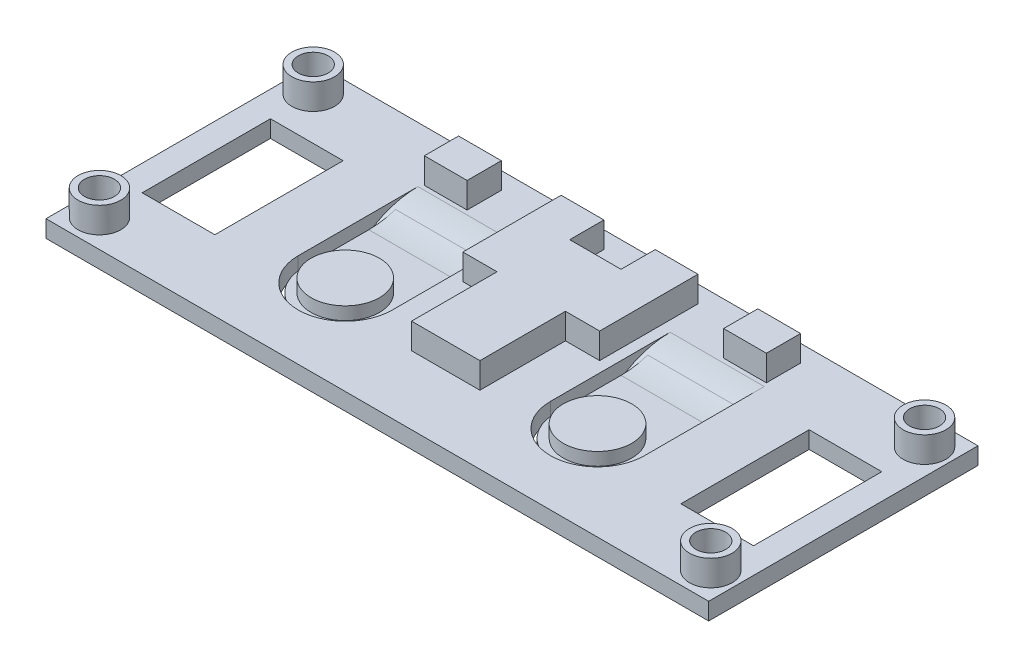
from build123d import *

# Parameters (mm, degrees)
SKETCH1_W                 = 77.5
SKETCH1_H                 = 31.5
BOSS_EXTRUDE1_DEPTH       = 2
CUT_EXTRUDE1_DEPTH        = 42.87630595
CUT_EXTRUDE1_DEPTH_BACK   = 42.87630595
SKETCH2_R                 = 1.75
CUT_EXTRUDE2_DEPTH        = 42.87630595
CUT_EXTRUDE2_DEPTH_BACK   = 42.87630595
SKETCH3_W                 = 8.5
SKETCH3_H                 = 15
BOSS_EXTRUDE2_START       = 3
SKETCH4_R                 = 2.5
SKETCH4_R_2               = 1.75
BOSS_EXTRUDE2_DEPTH       = 3
MIRROR2_START             = 3
MIRROR2_COPY_1_SKETCH_R   = 2.5
MIRROR2_COPY_1_SKETCH_R_2 = 1.75
MIRROR2_COPY_1_DEPTH      = 3
CUT_EXTRUDE3_DEPTH        = 3.5
SKETCH6_W                 = 8
SKETCH6_H                 = 10
SKETCH6_W_2               = 5
SKETCH6_H_2               = 4
BOSS_EXTRUDE3_DEPTH       = 3
SKETCH7_W                 = 16
SKETCH7_H                 = 7.5
BOSS_EXTRUDE4_DEPTH       = 3
CUT_EXTRUDE4_DEPTH        = 1
FILLET1_R                 = 10
FILLET2_R                 = 10
SKETCH9_R                 = 4
BOSS_EXTRUDE6_DEPTH       = 1.5


with BuildPart() as part:
    # Sketch1 → Boss-Extrude1 (new body)
    with BuildSketch(Plane(origin=(0, 0, 0), x_dir=(1, 0, 0), z_dir=(0, 1, 0))):
        Rectangle(SKETCH1_W, SKETCH1_H)
    extrude(amount=BOSS_EXTRUDE1_DEPTH)

    # Sketch2 → Cut-Extrude1 (cut, two sides: drawn at the far end of the back side and taken through both)
    with BuildSketch(Plane(origin=(0, 2, 0), x_dir=(1, 0, 0), z_dir=(0, 1, 0)).offset(-CUT_EXTRUDE1_DEPTH_BACK)):
        with Locations(Location((-35.75, 12.5, 0), (0, 0, 270))):
            Circle(SKETCH2_R)
        with Locations(Location((-35.75, -12.5, 0), (0, 0, 270))):
            Circle(SKETCH2_R)
        with Locations(Location((35.75, -12.5, 0), (0, 0, 270))):
            Circle(SKETCH2_R)
        with Locations(Location((35.75, 12.5, 0), (0, 0, 270))):
            Circle(SKETCH2_R)
    extrude(amount=CUT_EXTRUDE1_DEPTH + CUT_EXTRUDE1_DEPTH_BACK, mode=Mode.SUBTRACT)

    # Sketch3 → Cut-Extrude2 (cut, two sides: drawn at the far end of the back side and taken through both)
    with BuildSketch(Plane(origin=(0, 2, 0), x_dir=(1, 0, 0), z_dir=(0, 1, 0)).offset(-CUT_EXTRUDE2_DEPTH_BACK)):
        with Locations((31.5, 0)):
            Rectangle(SKETCH3_W, SKETCH3_H)
        with Locations((-31.5, 0)):
            Rectangle(SKETCH3_W, SKETCH3_H)
    extrude(amount=CUT_EXTRUDE2_DEPTH + CUT_EXTRUDE2_DEPTH_BACK, mode=Mode.SUBTRACT)

    # Sketch4 → Boss-Extrude2 (add)
    with BuildSketch(Plane(origin=(0, 2, 0), x_dir=(1, 0, 0), z_dir=(0, 1, 0)).offset(BOSS_EXTRUDE2_START)):
        with Locations(Location((-35.75, 12.5, 0), (0, 0, 270))):
            Circle(SKETCH4_R)
        with Locations(Location((-35.75, 12.5, 0), (0, 0, 270))):
            Circle(SKETCH4_R_2, mode=Mode.SUBTRACT)
    boss_extrude2 = extrude(amount=-BOSS_EXTRUDE2_DEPTH)

    # Mirror1: Boss-Extrude2 across plane
    add(boss_extrude2.mirror(Plane.XY))

    # Mirror2: Boss-Extrude2 across plane
    add(boss_extrude2.mirror(Plane(origin=(0, 0, 0), x_dir=(0, 0, 1), z_dir=(1, 0, 0))))

    # Mirror2 copy 1 sketch → Mirror2 copy 1 (add)
    with BuildSketch(Plane(origin=(0, 2, 0), x_dir=(-1, 0, 0), z_dir=(0, 1, 0)).offset(MIRROR2_START)):
        with Locations(Location((-35.75, 12.5, 0), (0, 0, 270))):
            Circle(MIRROR2_COPY_1_SKETCH_R)
        with Locations(Location((-35.75, 12.5, 0), (0, 0, 270))):
            Circle(MIRROR2_COPY_1_SKETCH_R_2, mode=Mode.SUBTRACT)
    extrude(amount=-MIRROR2_COPY_1_DEPTH)

    # Sketch5 → Cut-Extrude3 (cut)
    with BuildSketch(Plane(origin=(0, 2, 0), x_dir=(1, 0, 0), z_dir=(0, 1, 0))):
        with BuildLine():
            Line((19.75, -4.75), (19.75, 3.25))
            Line((19.75, 3.25), (20.25, 3.25))
            Line((20.25, 3.25), (20.25, -4.75))
            ThreePointArc((20.25, -4.75), (14.75, -10.25), (9.25, -4.75))
            Line((9.25, -4.75), (9.25, 3.25))
            Line((9.25, 3.25), (9.75, 3.25))
            Line((9.75, 3.25), (9.75, -4.75))
            ThreePointArc((9.75, -4.75), (14.75, -9.75), (19.75, -4.75))
        make_face()
        with BuildLine():
            Line((-19.75, 3.25), (-20.25, 3.25))
            Line((-20.25, 3.25), (-20.25, -4.75))
            ThreePointArc((-20.25, -4.75), (-14.75, -10.25), (-9.25, -4.75))
            Line((-9.25, -4.75), (-9.25, 3.25))
            Line((-9.25, 3.25), (-9.75, 3.25))
            Line((-9.75, 3.25), (-9.75, -4.75))
            ThreePointArc((-9.75, -4.75), (-14.75, -9.75), (-19.75, -4.75))
            Line((-19.75, -4.75), (-19.75, 3.25))
        make_face()
    extrude(amount=-CUT_EXTRUDE3_DEPTH, mode=Mode.SUBTRACT)

    # Sketch6 → Boss-Extrude3 (add)
    with BuildSketch(Plane(origin=(0, 2, 0), x_dir=(1, 0, 0), z_dir=(0, 1, 0))):
        with Locations((0, -2.75)):
            Rectangle(SKETCH6_W, SKETCH6_H)
        with Locations((5.5, 11.75)):
            Rectangle(SKETCH6_W_2, SKETCH6_H_2)
        with Locations((17.5, 11.75)):
            Rectangle(SKETCH6_W_2, SKETCH6_H_2)
        with Locations((-17.5, 11.75)):
            Rectangle(SKETCH6_W_2, SKETCH6_H_2)
        with Locations((-5.5, 11.75)):
            Rectangle(SKETCH6_W_2, SKETCH6_H_2)
    extrude(amount=BOSS_EXTRUDE3_DEPTH)

    # Sketch7 → Boss-Extrude4 (add)
    with BuildSketch(Plane(origin=(0, 2, 0), x_dir=(1, 0, 0), z_dir=(0, 1, 0))):
        with Locations((0, 6)):
            Rectangle(SKETCH7_W, SKETCH7_H)
    extrude(amount=BOSS_EXTRUDE4_DEPTH)

    # Sketch8 → Cut-Extrude4 (cut)
    with BuildSketch(Plane(origin=(0, 2, 0), x_dir=(1, 0, 0), z_dir=(0, 1, 0))):
        with BuildLine():
            Line((-9.75, 3.25), (-9.75, -4.75))
            ThreePointArc((-9.75, -4.75), (-14.75, -9.75), (-19.75, -4.75))
            Line((-19.75, -4.75), (-19.75, 3.25))
            Line((-19.75, 3.25), (-9.75, 3.25))
        make_face()
        with BuildLine():
            Line((19.75, 3.25), (9.75, 3.25))
            Line((9.75, 3.25), (9.75, -4.75))
            ThreePointArc((9.75, -4.75), (14.75, -9.75), (19.75, -4.75))
            Line((19.75, -4.75), (19.75, 3.25))
        make_face()
    extrude(amount=-CUT_EXTRUDE4_DEPTH, mode=Mode.SUBTRACT)

    # Fillet1
    # the kernel refuses this fillet: 10 mm, written as the material it takes off along each edge
    with BuildSketch(Plane(origin=(-4.75, 2, -3.25), x_dir=(0, 0, -1), z_dir=(-1, 0, 0))) as fillet1_piece_1_section:
        with BuildLine():
            CenterArc((6, 10), FILLET1_R, 233.130102354, 36.869897646)
            Line((0, 2), (0, 0))
            Line((0, 0), (6, 0))
        make_face()
    fillet1_piece_1 = extrude(amount=15.5, mode=Mode.PRIVATE)
    fillet1_piece_1 = split(fillet1_piece_1, bisect_by=Plane(origin=(-9.25, 2, -3.25), z_dir=(-1, 0, 0)), keep=Keep.TOP, mode=Mode.PRIVATE)
    fillet1_piece_1 = split(fillet1_piece_1, bisect_by=Plane(origin=(-4.75, 1, -3.25), z_dir=(0, 1, 0)), keep=Keep.TOP, mode=Mode.PRIVATE)
    add(fillet1_piece_1, mode=Mode.SUBTRACT)
    with BuildSketch(Plane(origin=(-4.75, 2, -3.25), x_dir=(0, 0, -1), z_dir=(-1, 0, 0))) as fillet1_piece_2_section:
        with BuildLine():
            CenterArc((6, 10), FILLET1_R, 233.130102354, 36.869897646)
            Line((0, 2), (0, 0))
            Line((0, 0), (6, 0))
        make_face()
    fillet1_piece_2 = extrude(amount=30.5, mode=Mode.PRIVATE)
    fillet1_piece_2 = split(fillet1_piece_2, bisect_by=Plane(origin=(-9.25, 2, -3.25), z_dir=(-1, 0, 0)), keep=Keep.TOP, mode=Mode.PRIVATE)
    fillet1_piece_2 = split(fillet1_piece_2, bisect_by=Plane(origin=(-9.75, 2, -3.25), z_dir=(1, 0, 0)), keep=Keep.TOP, mode=Mode.PRIVATE)
    add(fillet1_piece_2, mode=Mode.SUBTRACT)
    with BuildSketch(Plane(origin=(-19.75, 2, -3.25), x_dir=(0, 0, -1), z_dir=(-1, 0, 0)), Plane(origin=(-9.25, 2, -3.25), x_dir=(0, 0, -1), z_dir=(-1, 0, 0))) as fillet1_piece_3:
        with BuildLine():
            CenterArc((6, 10), FILLET1_R, 233.130102354, 36.869897646)
            Line((0, 2), (0, 0))
            Line((0, 0), (6, 0))
        make_face()
    extrude(amount=0.5, mode=Mode.SUBTRACT)
    with BuildSketch(Plane(origin=(-9.25, 2, -3.25), x_dir=(0, 0, -1), z_dir=(-1, 0, 0))) as fillet1_piece_4_section:
        with BuildLine():
            CenterArc((6, 10), FILLET1_R, 233.130102354, 36.869897646)
            Line((0, 2), (0, 0))
            Line((0, 0), (6, 0))
        make_face()
    fillet1_piece_4 = extrude(amount=15.5, mode=Mode.PRIVATE)
    fillet1_piece_4 = split(fillet1_piece_4, bisect_by=Plane(origin=(-20.25, 2, -3.25), z_dir=(1, 0, 0)), keep=Keep.TOP, mode=Mode.PRIVATE)
    fillet1_piece_4 = split(fillet1_piece_4, bisect_by=Plane(origin=(-9.25, 1, -3.25), z_dir=(0, 1, 0)), keep=Keep.TOP, mode=Mode.PRIVATE)
    add(fillet1_piece_4, mode=Mode.SUBTRACT)
    with BuildSketch(Plane(origin=(5.75, 2, -3.25), x_dir=(0, 0, -1), z_dir=(-1, 0, 0))) as fillet1_piece_5_section:
        with BuildLine():
            CenterArc((6, 10), FILLET1_R, 233.130102354, 36.869897646)
            Line((0, 2), (0, 0))
            Line((0, 0), (6, 0))
        make_face()
    fillet1_piece_5 = extrude(amount=30.5, mode=Mode.PRIVATE)
    fillet1_piece_5 = split(fillet1_piece_5, bisect_by=Plane(origin=(-20.25, 2, -3.25), z_dir=(1, 0, 0)), keep=Keep.TOP, mode=Mode.PRIVATE)
    fillet1_piece_5 = split(fillet1_piece_5, bisect_by=Plane(origin=(-19.75, 2, -3.25), z_dir=(-1, 0, 0)), keep=Keep.TOP, mode=Mode.PRIVATE)
    add(fillet1_piece_5, mode=Mode.SUBTRACT)
    with BuildSketch(Plane(origin=(4.75, 2, -3.25), x_dir=(0, 0, -1), z_dir=(1, 0, 0))) as fillet1_piece_6_section:
        with BuildLine():
            CenterArc((6, -10), FILLET1_R, 90, 36.869897646)
            Line((0, -2), (0, 0))
            Line((0, 0), (6, 0))
        make_face()
    fillet1_piece_6 = extrude(amount=15.5, mode=Mode.PRIVATE)
    fillet1_piece_6 = split(fillet1_piece_6, bisect_by=Plane(origin=(9.25, 2, -3.25), z_dir=(1, 0, 0)), keep=Keep.TOP, mode=Mode.PRIVATE)
    fillet1_piece_6 = split(fillet1_piece_6, bisect_by=Plane(origin=(4.75, 1, -3.25), z_dir=(0, 1, 0)), keep=Keep.TOP, mode=Mode.PRIVATE)
    add(fillet1_piece_6, mode=Mode.SUBTRACT)
    with BuildSketch(Plane(origin=(4.75, 2, -3.25), x_dir=(0, 0, -1), z_dir=(1, 0, 0))) as fillet1_piece_7_section:
        with BuildLine():
            CenterArc((6, -10), FILLET1_R, 90, 36.869897646)
            Line((0, -2), (0, 0))
            Line((0, 0), (6, 0))
        make_face()
    fillet1_piece_7 = extrude(amount=30.5, mode=Mode.PRIVATE)
    fillet1_piece_7 = split(fillet1_piece_7, bisect_by=Plane(origin=(9.75, 2, -3.25), z_dir=(-1, 0, 0)), keep=Keep.TOP, mode=Mode.PRIVATE)
    fillet1_piece_7 = split(fillet1_piece_7, bisect_by=Plane(origin=(9.25, 2, -3.25), z_dir=(1, 0, 0)), keep=Keep.TOP, mode=Mode.PRIVATE)
    add(fillet1_piece_7, mode=Mode.SUBTRACT)
    with BuildSketch(Plane(origin=(19.75, 2, -3.25), x_dir=(0, 0, -1), z_dir=(1, 0, 0)), Plane(origin=(9.25, 2, -3.25), x_dir=(0, 0, -1), z_dir=(1, 0, 0))) as fillet1_piece_8:
        with BuildLine():
            CenterArc((6, -10), FILLET1_R, 90, 36.869897646)
            Line((0, -2), (0, 0))
            Line((0, 0), (6, 0))
        make_face()
    extrude(amount=0.5, mode=Mode.SUBTRACT)
    with BuildSketch(Plane(origin=(9.25, 2, -3.25), x_dir=(0, 0, -1), z_dir=(1, 0, 0))) as fillet1_piece_9_section:
        with BuildLine():
            CenterArc((6, -10), FILLET1_R, 90, 36.869897646)
            Line((0, -2), (0, 0))
            Line((0, 0), (6, 0))
        make_face()
    fillet1_piece_9 = extrude(amount=15.5, mode=Mode.PRIVATE)
    fillet1_piece_9 = split(fillet1_piece_9, bisect_by=Plane(origin=(20.25, 2, -3.25), z_dir=(-1, 0, 0)), keep=Keep.TOP, mode=Mode.PRIVATE)
    fillet1_piece_9 = split(fillet1_piece_9, bisect_by=Plane(origin=(9.25, 1, -3.25), z_dir=(0, 1, 0)), keep=Keep.TOP, mode=Mode.PRIVATE)
    add(fillet1_piece_9, mode=Mode.SUBTRACT)
    with BuildSketch(Plane(origin=(-5.75, 2, -3.25), x_dir=(0, 0, -1), z_dir=(1, 0, 0))) as fillet1_piece_10_section:
        with BuildLine():
            CenterArc((6, -10), FILLET1_R, 90, 36.869897646)
            Line((0, -2), (0, 0))
            Line((0, 0), (6, 0))
        make_face()
    fillet1_piece_10 = extrude(amount=30.5, mode=Mode.PRIVATE)
    fillet1_piece_10 = split(fillet1_piece_10, bisect_by=Plane(origin=(19.75, 2, -3.25), z_dir=(1, 0, 0)), keep=Keep.TOP, mode=Mode.PRIVATE)
    fillet1_piece_10 = split(fillet1_piece_10, bisect_by=Plane(origin=(20.25, 2, -3.25), z_dir=(-1, 0, 0)), keep=Keep.TOP, mode=Mode.PRIVATE)
    add(fillet1_piece_10, mode=Mode.SUBTRACT)

    # Fillet2
    # the kernel refuses this fillet: 10 mm, written as the material it adds along each edge
    with BuildSketch(Plane(origin=(19.75, 1, -4.891101056), x_dir=(0, 0.3749043717325089, -0.9270634886866448), z_dir=(-1, 0, 0))) as fillet2_piece_1:
        with BuildLine():
            CenterArc((2.000510148, -9.977741668), FILLET2_R, 93.823530212, 18.194872339)
            Line((-1.74853357, -0.707106781), (0, 0))
            ThreePointArc((0, 0), (0.666836716, -0.022258332), (1.333673432, 0))
        make_face()
    extrude(amount=10)
    with BuildSketch(Plane(origin=(-19.75, 1, -4.891101056), x_dir=(0, 0.3749043717325089, -0.9270634886866448), z_dir=(1, 0, 0))) as fillet2_piece_2:
        with BuildLine():
            CenterArc((2.000510148, 9.977741668), FILLET2_R, 247.981597449, 18.194872339)
            Line((-1.74853357, 0.707106781), (0, 0))
            ThreePointArc((0, 0), (0.666836716, 0.022258332), (1.333673432, 0))
        make_face()
    extrude(amount=10)

    # Sketch9 → Boss-Extrude6 (add)
    with BuildSketch(Plane(origin=(0, 1, 0), x_dir=(1, 0, 0), z_dir=(0, 1, 0))):
        with Locations(Location((14.75, -4.75, 0), (0, 0, 90))):
            Circle(SKETCH9_R)
        with Locations(Location((-14.75, -4.75, 0), (0, 0, 90))):
            Circle(SKETCH9_R)
    extrude(amount=BOSS_EXTRUDE6_DEPTH)


solid = part.part
